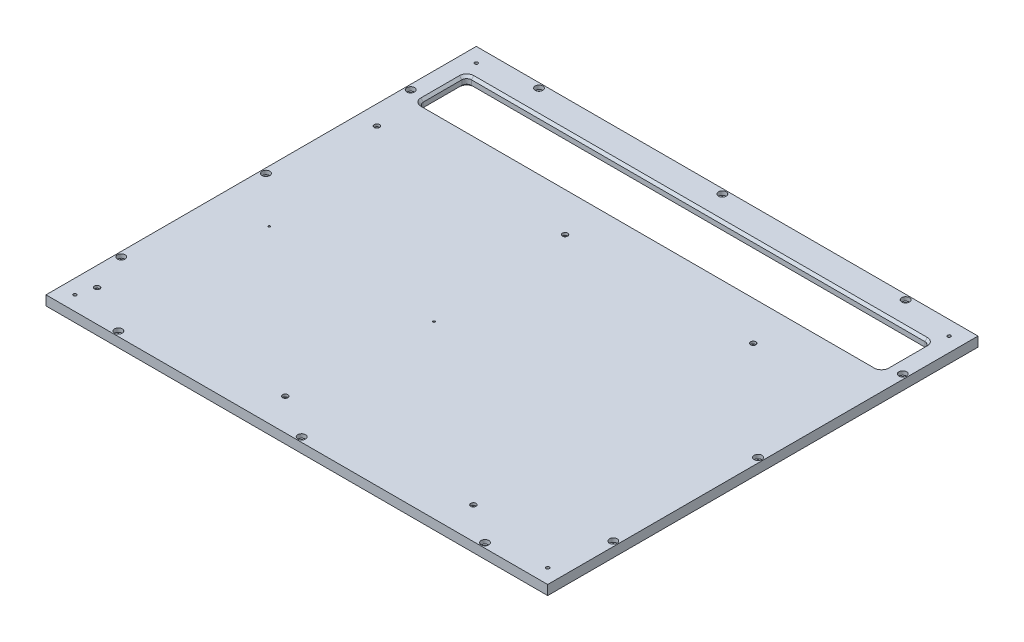
from build123d import *

# Parameters (mm, degrees)
SKETCH1_W                        = 520
SKETCH1_H                        = 446
BOSS_EXTRUDE1_DEPTH              = 10
SKETCH4_W                        = 480
SKETCH4_H                        = 50
CUT_EXTRUDE1_DEPTH               = 10
FILLET1_R                        = 5
CHAMFER1_SIZE                    = 2.5
CBORE_FOR_M4_SHCS1_D             = 4.5
CBORE_FOR_M4_SHCS1_DEPTH         = 12
CBORE_FOR_M4_SHCS1_CBORE_D       = 8
CBORE_FOR_M4_SHCS1_CBORE_DEPTH   = 4
CBORE_FOR_M4_SHCS1_TIP           = 1.351936393
M4X0_7_TAPPED_HOLE1_D            = 3.3
CBORE_FOR_M2_5_SHCS1_D           = 2.9
CBORE_FOR_M2_5_SHCS1_CBORE_D     = 5.5
CBORE_FOR_M2_5_SHCS1_CBORE_DEPTH = 2.5
M2_5X0_45_TAPPED_HOLE1_D         = 2.05


with BuildPart() as part:
    # Sketch1 → Boss-Extrude1 (new body)
    with BuildSketch(Plane(origin=(0, 0, 0), x_dir=(1, 0, 0), z_dir=(0, 1, 0))):
        with Locations((260, 223)):
            Rectangle(SKETCH1_W, SKETCH1_H)
    extrude(amount=BOSS_EXTRUDE1_DEPTH)

    # Sketch4 → Cut-Extrude1 (cut)
    with BuildSketch(Plane(origin=(0, 10, 0), x_dir=(1, 0, 0), z_dir=(0, 1, 0))):
        with Locations((260, 391)):
            Rectangle(SKETCH4_W, SKETCH4_H)
    extrude(amount=-CUT_EXTRUDE1_DEPTH, mode=Mode.SUBTRACT)

    # Fillet1
    fillet1_edges = [part.edges().sort_by_distance(p)[0] for p in [
        (500, 5, -366),
        (20, 5, -416),
        (500, 5, -416),
        (20, 5, -366),
    ]]
    fillet(fillet1_edges, radius=FILLET1_R)

    # Chamfer1
    chamfer1_edges = [part.edges().sort_by_distance(p)[0] for p in [
        (21.464466094, 10, -367.464466094),
        (260, 10, -366),
        (498.535533906, 10, -367.464466094),
        (500, 10, -391),
        (498.535533906, 10, -414.535533906),
        (260, 10, -416),
        (21.464466094, 10, -414.535533906),
        (20, 10, -391),
        (21.464466094, 0, -367.464466094),
        (20, 0, -391),
        (21.464466094, 0, -414.535533906),
        (260, 0, -416),
        (498.535533906, 0, -414.535533906),
        (500, 0, -391),
        (498.535533906, 0, -367.464466094),
        (260, 0, -366),
    ]]
    chamfer(chamfer1_edges, length=CHAMFER1_SIZE)

    # CBORE for M4 SHCS1
    with Locations(Plane(origin=(0, 10, 0), x_dir=(1, 0, 0), z_dir=(0, 1, 0))):
        with Locations((5, 373), (5, 223), (5, 73), (70, 5), (260, 5), (450, 5), (515, 73), (515, 223), (515, 373), (450, 441), (260, 441), (70, 441)):
            CounterBoreHole(CBORE_FOR_M4_SHCS1_D / 2, CBORE_FOR_M4_SHCS1_CBORE_D / 2, CBORE_FOR_M4_SHCS1_CBORE_DEPTH, depth=CBORE_FOR_M4_SHCS1_DEPTH)
            with Locations((0, 0, -(CBORE_FOR_M4_SHCS1_DEPTH + CBORE_FOR_M4_SHCS1_TIP / 2))):  # 118° drill point
                Cone(0, CBORE_FOR_M4_SHCS1_D / 2, CBORE_FOR_M4_SHCS1_TIP, mode=Mode.SUBTRACT)

    # M4x0.7 Tapped Hole1 (through all)
    with Locations(Plane(origin=(0, 10, 0), x_dir=(1, 0, 0), z_dir=(0, 1, 0))):
        with Locations((15, 431), (505, 431), (15, 15), (505, 15)):
            Hole(M4X0_7_TAPPED_HOLE1_D / 2)

    # CBORE for M2.5 SHCS1 (through all)
    with Locations(Plane(origin=(0, 10, 0), x_dir=(1, 0, 0), z_dir=(0, 1, 0))):
        with Locations((20, 33), (215, 33), (410, 33), (410, 323), (215, 323), (20, 323)):
            CounterBoreHole(CBORE_FOR_M2_5_SHCS1_D / 2, CBORE_FOR_M2_5_SHCS1_CBORE_D / 2, CBORE_FOR_M2_5_SHCS1_CBORE_DEPTH)

    # M2.5x0.45 Tapped Hole1 (through all)
    with Locations(Plane(origin=(0, 10, 0), x_dir=(1, 0, 0), z_dir=(0, 1, 0))):
        with Locations((54.288, 177.08759), (225.088, 177.08759)):
            Hole(M2_5X0_45_TAPPED_HOLE1_D / 2)


solid = part.part
